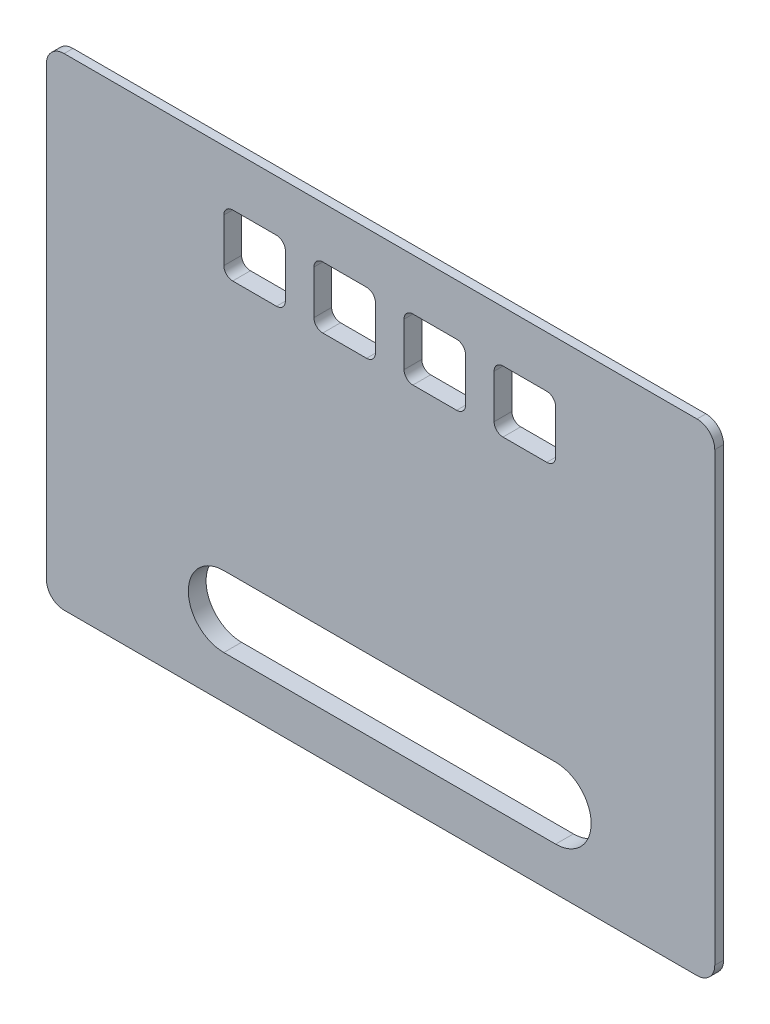
from build123d import *

# Parameters (mm, degrees)
SKETCH_1_W                                = 107
SKETCH_1_H                                = 74
EXTRUDE_1_DEPTH                           = 3
EXTRUDE_START                             = 1.5
SKETCH_2_W                                = 113
SKETCH_2_H                                = 80
EXTRUDE_2_DEPTH                           = 1.5
SKETCH_3_W                                = 10.4
SKETCH_3_H                                = 10.4
CUT_EXTRUDE_1_DEPTH                       = 5
SKETCH_4_W                                = 107
SKETCH_4_H                                = 1.5
TOP_REAR_INNER_EXTENSION_1P5MM_DEPTH      = 3
TOP_REAR_OUTER_SKIN_EXTENSION_1P5MM_START = 1.5
SKETCH_5_W                                = 113
SKETCH_5_H                                = 1.5
TOP_REAR_OUTER_SKIN_EXTENSION_1P5MM_DEPTH = 1.5
TOOL_D3_R1P5_BUTTON_CORNERS_R             = 1.5
TOOL_D3_R3_TOP_OUTER_CONTOUR_R            = 3


with BuildPart() as part:
    # Эскиз1 → Бобышка-Вытянуть1 (new body)
    with BuildSketch(Plane.XY):
        with Locations((53.5, 40)):
            Rectangle(SKETCH_1_W, SKETCH_1_H)
    extrude(amount=EXTRUDE_1_DEPTH)

    # Эскиз2 → Бобышка-Вытянуть2 (add)
    with BuildSketch(Plane.XY.offset(EXTRUDE_START)):
        with Locations((53.5, 40)):
            Rectangle(SKETCH_2_W, SKETCH_2_H)
    extrude(amount=EXTRUDE_2_DEPTH)

    # Эскиз3 → Вырез-Вытянуть1 (cut)
    with BuildSketch(Plane(origin=(0.75, 0, 3), x_dir=(1, 0, 0), z_dir=(0, 0, 1))):
        with Locations((31.45, 67.65)):
            Rectangle(SKETCH_3_W, SKETCH_3_H)
        with Locations((46.683, 67.65)):
            Rectangle(SKETCH_3_W, SKETCH_3_H)
        with Locations((61.917, 67.65)):
            Rectangle(SKETCH_3_W, SKETCH_3_H)
        with Locations((77.15, 67.65)):
            Rectangle(SKETCH_3_W, SKETCH_3_H)
        with BuildLine():
            Line((26.25, 19.3), (82.35, 19.3))
            ThreePointArc((82.35, 19.3), (88.35, 13.3), (82.35, 7.3))
            Line((82.35, 7.3), (26.25, 7.3))
            ThreePointArc((26.25, 7.3), (20.25, 13.3), (26.25, 19.3))
        make_face()
    extrude(amount=-CUT_EXTRUDE_1_DEPTH, mode=Mode.SUBTRACT)

    # Эскиз4 → top_rear_inner_extension_1p5mm (add)
    with BuildSketch(Plane.XY):
        with Locations((53.5, 77.75)):
            Rectangle(SKETCH_4_W, SKETCH_4_H)
    extrude(amount=TOP_REAR_INNER_EXTENSION_1P5MM_DEPTH)

    # Эскиз5 → top_rear_outer_skin_extension_1p5mm (add)
    with BuildSketch(Plane.XY.offset(TOP_REAR_OUTER_SKIN_EXTENSION_1P5MM_START)):
        with Locations((53.5, 80.75)):
            Rectangle(SKETCH_5_W, SKETCH_5_H)
    extrude(amount=TOP_REAR_OUTER_SKIN_EXTENSION_1P5MM_DEPTH)

    # tool_D3_R1p5_button_corners
    tool_d3_r1p5_button_corners_edges = [part.edges().sort_by_distance(p)[0] for p in [
        (72.7, 72.85, 1.5),
        (83.1, 72.85, 1.5),
        (83.1, 62.45, 1.5),
        (72.7, 62.45, 1.5),
        (57.467, 72.85, 1.5),
        (67.867, 72.85, 1.5),
        (67.867, 62.45, 1.5),
        (57.467, 62.45, 1.5),
        (42.233, 72.85, 1.5),
        (52.633, 72.85, 1.5),
        (52.633, 62.45, 1.5),
        (42.233, 62.45, 1.5),
        (27, 62.45, 1.5),
        (37.4, 62.45, 1.5),
        (37.4, 72.85, 1.5),
        (27, 72.85, 1.5),
    ]]
    fillet(tool_d3_r1p5_button_corners_edges, radius=TOOL_D3_R1P5_BUTTON_CORNERS_R)

    # tool_D3_R3_top_outer_contour
    tool_d3_r3_top_outer_contour_edges = [part.edges().sort_by_distance(p)[0] for p in [
        (-3, 81.5, 2.25),
        (110, 81.5, 2.25),
        (110, 0, 2.25),
        (-3, 0, 2.25),
    ]]
    fillet(tool_d3_r3_top_outer_contour_edges, radius=TOOL_D3_R3_TOP_OUTER_CONTOUR_R)


solid = part.part
